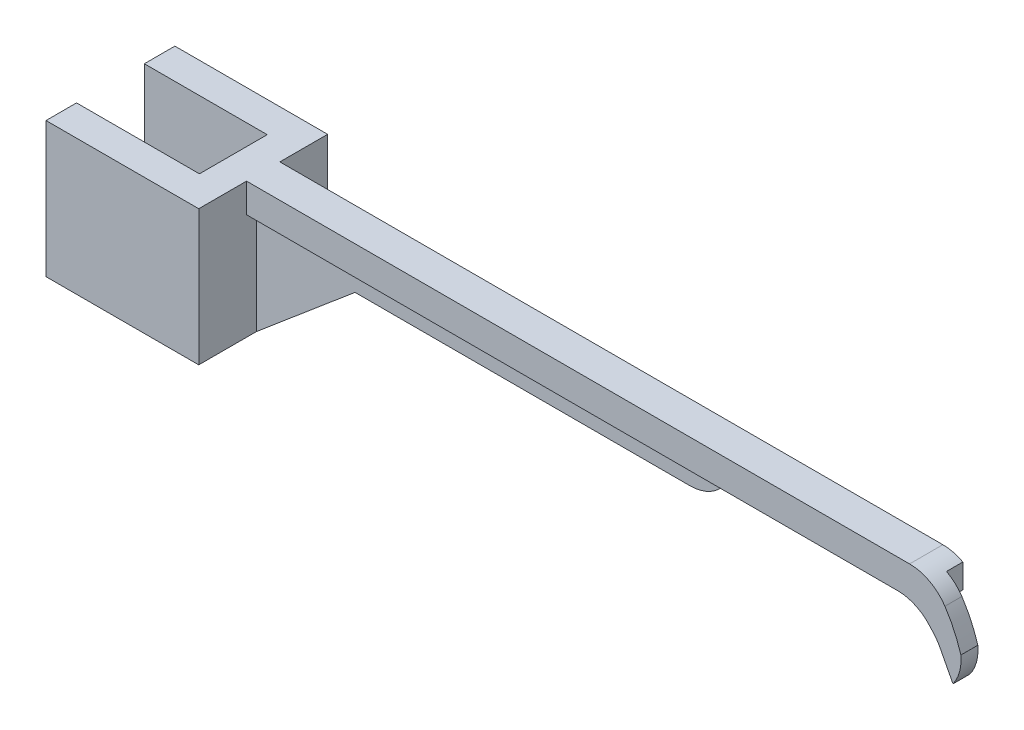
from build123d import *

# Parameters (mm, degrees)
SKETCH1_W            = 60
SKETCH1_H            = 7.5
BOSS_EXTRUDE1_DEPTH  = 13
SKETCH3_W            = 12
SKETCH3_H            = 5
CUT_EXTRUDE1_DEPTH   = 10.5
SKETCH4_R            = 1
CUT_EXTRUDE2_DEPTH   = 10
SKETCH9_W            = 45.277568689
SKETCH9_H            = 2.15
CUT_EXTRUDE8_DEPTH   = 15
SKETCH13_W           = 45.277568689
SKETCH13_H           = 3.2
CUT_EXTRUDE10_DEPTH  = 8
SKETCH14_W           = 45.277568689
SKETCH14_H           = 0.95
CUT_EXTRUDE11_DEPTH  = 2.2
RIB10_REACH          = 34.91
SKETCH16_WALL_W      = 80.220727034
SKETCH16_WALL_H      = 1.3
SKETCH20_W           = 12
SKETCH20_H           = 5
BOSS_EXTRUDE3_DEPTH  = 3
SKETCH22_W           = 12
SKETCH22_H           = 5
CUT_EXTRUDE13_DEPTH  = 1.95
CUT_EXTRUDE14_START  = -10
SKETCH23_R           = 1
CUT_EXTRUDE14_DEPTH  = 10
SCALE1_SCALE         = 1.6
SCALE3_SCALE         = 0.8
SCALE4_SCALE         = 0.95890411
SKETCH34_W           = 14.546034326
SKETCH34_H           = 7.999999695
CUT_EXTRUDE20_DEPTH  = 15
SKETCH39_W           = 3.927671232
SKETCH39_H           = 3.436712329
BOSS_EXTRUDE5_DEPTH  = 25
BOSS_EXTRUDE6_DEPTH  = 2
FILLET1_R            = 15
FILLET3_R            = 5
BOSS_EXTRUDE7_DEPTH  = 2
FILLET4_R            = 5
FILLET5_R            = 5
FILLET6_R            = 5
FILLET7_R            = 5
SKETCH52_W           = 9.205479452
SKETCH52_H           = 15.956164384
CUT_EXTRUDE21_DEPTH  = 0.05
SKETCH54_W           = 0.182732797
SKETCH54_H           = 6.136986302
BOSS_EXTRUDE8_DEPTH  = 15
SKETCH55_W           = 6.136986302
SKETCH55_H           = 3.40109589
CUT_EXTRUDE22_DEPTH  = 15
SKETCH57_W           = 14.496034326
SKETCH57_H           = 7.999999695
CUT_EXTRUDE23_DEPTH  = 12.16
SKETCH58_W           = 18.020271855
SKETCH58_H           = 15.956164384
BOSS_EXTRUDE9_DEPTH  = 3
SKETCH59_W           = 18.020271855
SKETCH59_H           = 15.956164384
BOSS_EXTRUDE10_DEPTH = 3


with BuildPart() as part:
    # Sketch1 → Boss-Extrude1 (new body)
    with BuildSketch(Plane(origin=(0, 0, 0), x_dir=(1, 0, 0), z_dir=(0, 1, 0))):
        Rectangle(SKETCH1_W, SKETCH1_H)
    extrude(amount=BOSS_EXTRUDE1_DEPTH)

    # Sketch3 → Cut-Extrude1 (cut)
    with BuildSketch(Plane(origin=(0, 13, 0), x_dir=(1, 0, 0), z_dir=(0, 1, 0))):
        with Locations((-24, 0)):
            Rectangle(SKETCH3_W, SKETCH3_H)
    extrude(amount=-CUT_EXTRUDE1_DEPTH, mode=Mode.SUBTRACT)

    # Sketch4 → Cut-Extrude2 (cut)
    with BuildSketch(Plane(origin=(0, 2.5, 0), x_dir=(1, 0, 0), z_dir=(0, 1, 0))):
        with Locations(Location((-21, 0, 0), (0, 0, 270))):
            Circle(SKETCH4_R)
        with Locations(Location((-26.7, 0, 0), (0, 0, 270))):
            Circle(SKETCH4_R)
    extrude(amount=-CUT_EXTRUDE2_DEPTH, mode=Mode.SUBTRACT)

    # Sketch9 → Cut-Extrude8 (cut)
    with BuildSketch(Plane.XZ):
        with Locations((7.361215656, 2.675)):
            Rectangle(SKETCH9_W, SKETCH9_H)
        with Locations((7.361215656, -2.675)):
            Rectangle(SKETCH9_W, SKETCH9_H)
    extrude(amount=-CUT_EXTRUDE8_DEPTH, mode=Mode.SUBTRACT)

    # Sketch13 → Cut-Extrude10 (cut)
    with BuildSketch(Plane.XZ):
        with Locations((7.361215656, 0)):
            Rectangle(SKETCH13_W, SKETCH13_H)
    extrude(amount=-CUT_EXTRUDE10_DEPTH, mode=Mode.SUBTRACT)

    # Sketch14 → Cut-Extrude11 (cut)
    with BuildSketch(Plane.XZ.offset(-8)):
        with Locations((7.361215656, 1.125)):
            Rectangle(SKETCH14_W, SKETCH14_H)
        with Locations((7.361215656, -1.125)):
            Rectangle(SKETCH14_W, SKETCH14_H)
    extrude(amount=-CUT_EXTRUDE11_DEPTH, mode=Mode.SUBTRACT)

    # Sketch16 wall → Rib10 (add, up to next)
    with BuildSketch(Plane(origin=(-10.539893857, 4, 0), x_dir=(-0.764085816902, -0.645114613389, 0), z_dir=(0.645114613389, -0.764085816902, 0)), mode=Mode.PRIVATE) as rib10_sk1:
        Rectangle(SKETCH16_WALL_W, SKETCH16_WALL_H)
    rib10_tool1 = extrude(rib10_sk1.sketch, amount=-RIB10_REACH, mode=Mode.PRIVATE) - part.part
    add(rib10_tool1.solids().sort_by_distance((-10.539893857, 4, 0))[0])

    # Sketch20 → Boss-Extrude3 (add)
    with BuildSketch(Plane(origin=(0, 2.5, 0), x_dir=(1, 0, 0), z_dir=(0, 1, 0))):
        with Locations((-24, 0)):
            Rectangle(SKETCH20_W, SKETCH20_H)
    extrude(amount=BOSS_EXTRUDE3_DEPTH)

    # Sketch22 → Cut-Extrude13 (cut)
    with BuildSketch(Plane(origin=(0, 5.5, 0), x_dir=(1, 0, 0), z_dir=(0, 1, 0))):
        with Locations((-24, 0)):
            Rectangle(SKETCH22_W, SKETCH22_H)
    extrude(amount=-CUT_EXTRUDE13_DEPTH, mode=Mode.SUBTRACT)

    # Sketch23 → Cut-Extrude14 (cut)
    with BuildSketch(Plane.XZ.offset(CUT_EXTRUDE14_START)):
        with Locations(Location((-26.7, 0, 0), (0, 0, 90))):
            Circle(SKETCH23_R)
        with Locations(Location((-21, 0, 0), (0, 0, 90))):
            Circle(SKETCH23_R)
    extrude(amount=CUT_EXTRUDE14_DEPTH, mode=Mode.SUBTRACT)


with BuildPart() as part_1:
    # Scale1: scaled about (-10.495093685, 7.511594664, 0)
    add(part.part.scale(SCALE1_SCALE).moved(Location((6.297056211, -4.506956798, 0))))


with BuildPart() as part_2:
    # Scale3: scaled about (-10.495093686, 7.511594664, 0)
    add(part_1.part.scale(SCALE3_SCALE).moved(Location((-2.099018737, 1.502318933, 0))))


with BuildPart() as part_3:
    # Scale4: scaled about (-10.495093686, 7.511594664, 0)
    add(part_2.part.scale(SCALE4_SCALE).moved(Location((-0.43130522, 0.308695671, 0))))

    # Sketch34 → Cut-Extrude20 (cut)
    with BuildSketch(Plane(origin=(0, 2.649144227, 0), x_dir=(1, 0, 0), z_dir=(0, 1, 0))):
        with Locations((-27.162345095, -7.59e-07)):
            Rectangle(SKETCH34_W, SKETCH34_H)
    extrude(amount=CUT_EXTRUDE20_DEPTH, mode=Mode.SUBTRACT)

    # Sketch39 → Boss-Extrude5 (add)
    with BuildSketch(Plane(origin=(39.208473359, 0, 0), x_dir=(0, 0, -1), z_dir=(1, 0, 0))):
        with Locations((0, 12.529692173)):
            Rectangle(SKETCH39_W, SKETCH39_H)
    extrude(amount=BOSS_EXTRUDE5_DEPTH)

    # Sketch45 → Boss-Extrude6 (add)
    with BuildSketch(Plane.XY.offset(1.963835616)):
        Polygon((64.208473359, 14.248048337), (67.197905162, 11.258616533), (67.903164447, 7.966965022), (68.244364149, 4.408739558), (65.703189261, 8.649364426), (64.208473359, 10.811336008), align=None)
    extrude(amount=-BOSS_EXTRUDE6_DEPTH)

    # Fillet1
    # the kernel refuses this fillet: 15 mm, written as the material it takes off along each edge
    with BuildSketch(Plane(origin=(67.197905162, 11.258616533, 12.842753048), x_dir=(-0.7071067811865568, 0.7071067811865384, 0), z_dir=(0, 0, -1))) as fillet1_piece_1:
        with BuildLine():
            CenterArc((4.351566973, -15), FILLET1_R, 90, 28.588827617)
            Line((-2.826242727, -1.828855482), (0, 0))
            Line((0, 0), (4.351566973, 0))
        make_face()
    extrude(amount=23.757834864, mode=Mode.SUBTRACT)

    # Fillet3
    fillet3_edges = [part_3.edges().sort_by_distance(p)[0] for p in [
        (64.207755923, 14.248048337, 0),
    ]]
    fillet(fillet3_edges, radius=FILLET3_R)

    # Sketch47 → Boss-Extrude7 (add)
    with BuildSketch(Plane.XY.offset(1.963835616)):
        Polygon((62.681686065, 10.811336008), (65.137458222, 8.07903323), (66.974128155, 4.550150551), (68.244364149, 4.408739558), (65.703189261, 8.649364426), (64.208473359, 10.811336008), align=None)
    extrude(amount=-BOSS_EXTRUDE7_DEPTH)

    # Fillet4
    fillet4_edges = [part_3.edges().sort_by_distance(p)[0] for p in [
        (62.681686065, 10.811336008, 0.963835616),
    ]]
    fillet(fillet4_edges, radius=FILLET4_R)

    # Fillet5
    fillet5_edges = [part_3.edges().sort_by_distance(p)[0] for p in [
        (65.137458222, 8.07903323, 0.963835616),
    ]]
    fillet(fillet5_edges, radius=FILLET5_R)

    # Fillet6
    # the kernel refuses this fillet: 5 mm, written as the material it takes off along each edge
    with BuildSketch(Plane(origin=(68.244364149, 4.408739558, 10.889498263), x_dir=(-0.993860211442073, 0.11064303011178676, 0), z_dir=(0, 0, -1))) as fillet6_piece_1:
        with BuildLine():
            CenterArc((5.625725169, 2.469414691), FILLET6_R, 168.170246518, 41.425870444)
            Line((0.731919855, 3.494436423), (0.634043748, 3.514936858))
            Line((0.634043748, 3.514936858), (-0.097876106, 0.020500435))
            Line((-0.097876106, 0.020500435), (0, -0.1))
            ThreePointArc((0, -0.1), (0.639041577, -0.1), (1.191130314, -0.049388294))
            Line((1.191130314, -0.049388294), (1.278083154, 0))
        make_face()
    extrude(amount=19.851325293, mode=Mode.SUBTRACT)

    # Fillet7
    # the kernel refuses this fillet: 5 mm, written as the material it takes off along each edge
    with BuildSketch(Plane(origin=(39.208473358, 8.111062035, -11.897149471), x_dir=(1.1344900488242768e-10, 1.0, 0), z_dir=(0, 0, 1))) as fillet7_piece_1:
        with BuildLine():
            CenterArc((4.999999999, 4.439736501), FILLET7_R, 180.000000007, 62.61642823)
            Line((-1e-09, 4.439736501), (-0.100000001, 4.439736501))
            Line((-0.100000001, 4.439736501), (-0.1, 0))
            Line((-0.1, 0), (0, -0.1))
            ThreePointArc((0, -0.1), (1.350136986, -0.1), (2.654279452, -0.08879473))
            Line((2.654279452, -0.08879473), (2.700273973, 0))
        make_face()
    extrude(amount=23.794298942, mode=Mode.SUBTRACT)

    # Sketch52 → Cut-Extrude21 (cut)
    with BuildSketch(Plane.ZY.offset(34.435362258)):
        with Locations((0, 6.269966145)):
            Rectangle(SKETCH52_W, SKETCH52_H)
    extrude(amount=-CUT_EXTRUDE21_DEPTH, mode=Mode.SUBTRACT)

    # Sketch54 → Boss-Extrude8 (add)
    with BuildSketch(Plane(origin=(0, 2.649144227, 0), x_dir=(1, 0, 0), z_dir=(0, 1, 0))):
        with Locations((-19.797961534, 0)):
            Rectangle(SKETCH54_W, SKETCH54_H)
    extrude(amount=BOSS_EXTRUDE8_DEPTH)

    # Sketch55 → Cut-Extrude22 (cut)
    with BuildSketch(Plane(origin=(-19.706595135, 0, 0), x_dir=(0, 0, -1), z_dir=(1, 0, 0))):
        with Locations((0, 15.948596282)):
            Rectangle(SKETCH55_W, SKETCH55_H)
    extrude(amount=-CUT_EXTRUDE22_DEPTH, mode=Mode.SUBTRACT)

    # Sketch57 → Cut-Extrude23 (cut)
    with BuildSketch(Plane(origin=(0, 14.248048337, 0), x_dir=(1, 0, 0), z_dir=(0, 1, 0))):
        with Locations((-27.137345095, -7.59e-07)):
            Rectangle(SKETCH57_W, SKETCH57_H)
    extrude(amount=-CUT_EXTRUDE23_DEPTH, mode=Mode.SUBTRACT)

    # Sketch58 → Boss-Extrude9 (add)
    with BuildSketch(Plane.XY.offset(4.602739726)):
        with Locations((-25.37522633, 6.269966145)):
            Rectangle(SKETCH58_W, SKETCH58_H)
    extrude(amount=BOSS_EXTRUDE9_DEPTH)

    # Sketch59 → Boss-Extrude10 (add)
    with BuildSketch(Plane(origin=(0, 0, -4.602739726), x_dir=(-1, 0, 0), z_dir=(0, 0, -1))):
        with Locations((25.37522633, 6.269966145)):
            Rectangle(SKETCH59_W, SKETCH59_H)
    extrude(amount=BOSS_EXTRUDE10_DEPTH)


solid = part_3.part
